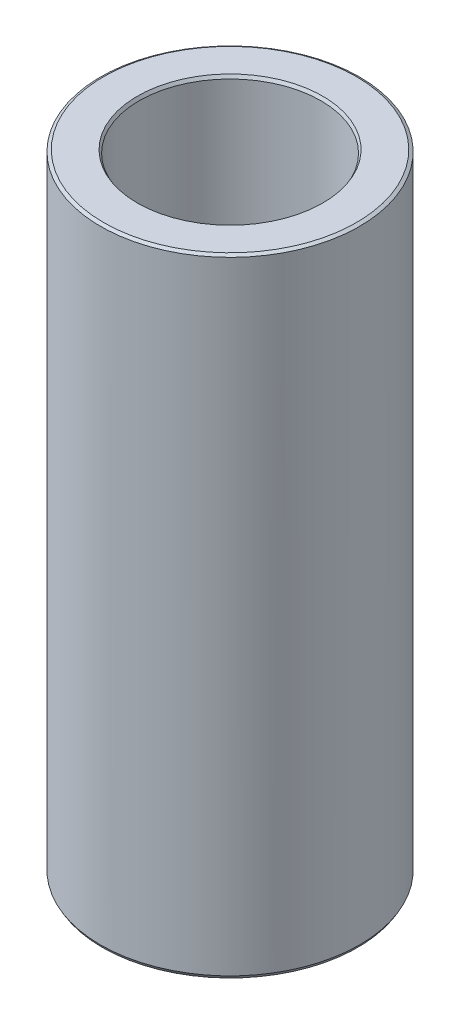
from build123d import *
from OCP.BRepFilletAPI import BRepFilletAPI_MakeChamfer

# Parameters (mm, degrees)
SKETCH1_R           = 52.5
BOSS_EXTRUDE1_DEPTH = 254.278853802
SKETCH2_R           = 36.846720765
CUT_EXTRUDE1_DEPTH  = 265.896650584
CHAMFER1_SIZE       = 0.721615891
CHAMFER1_SIZE2      = 1.249875387


with BuildPart() as part:
    # Sketch1 → Boss-Extrude1 (new body)
    with BuildSketch(Plane(origin=(0, 0, 0), x_dir=(1, 0, 0), z_dir=(0, 1, 0))):
        Circle(SKETCH1_R)
    extrude(amount=BOSS_EXTRUDE1_DEPTH)

    # Sketch2 → Cut-Extrude1 (cut, through all)
    with BuildSketch(Plane(origin=(0, 0, 0), x_dir=(1, 0, 0), z_dir=(0, 1, 0))):
        Circle(SKETCH2_R)
    extrude(amount=CUT_EXTRUDE1_DEPTH, mode=Mode.SUBTRACT)

    # Chamfer1: one chamfer whose edges measure the first distance from different faces: ONE call of the kernel's chamfer builder (chamfer() names one face for all edges)
    chamfer1_edges_1 = [part.edges().sort_by_distance(p)[0] for p in [
        (-36.846720765, 254.278853802, 0),
    ]]
    chamfer1_side_1 = [part.faces().sort_by_distance(p)[0] for p in [
        (-51.01507576, 254.278853802, 0),
    ]]
    chamfer1_edges_2 = [part.edges().sort_by_distance(p)[0] for p in [
        (-36.846720765, 0, 0),
    ]]
    chamfer1_side_2 = [part.faces().sort_by_distance(p)[0] for p in [
        (-36.846720765, 127.139426901, 0),
    ]]
    chamfer1_edges_3 = [part.edges().sort_by_distance(p)[0] for p in [
        (-52.5, 0, 0),
    ]]
    chamfer1_side_3 = [part.faces().sort_by_distance(p)[0] for p in [
        (-51.01507576, 0, 0),
    ]]
    chamfer1_edges_4 = [part.edges().sort_by_distance(p)[0] for p in [
        (-52.5, 254.278853802, 0),
    ]]
    chamfer1_side_4 = [part.faces().sort_by_distance(p)[0] for p in [
        (-52.5, 127.139426901, 0),
    ]]
    chamfer1 = BRepFilletAPI_MakeChamfer(part.part.solid().wrapped)
    for e in chamfer1_edges_1:
        chamfer1.Add(CHAMFER1_SIZE, CHAMFER1_SIZE2, e.wrapped, chamfer1_side_1[0].wrapped)  # the first distance lies on this face
    for e in chamfer1_edges_2:
        chamfer1.Add(CHAMFER1_SIZE, CHAMFER1_SIZE2, e.wrapped, chamfer1_side_2[0].wrapped)  # the first distance lies on this face
    for e in chamfer1_edges_3:
        chamfer1.Add(CHAMFER1_SIZE, CHAMFER1_SIZE2, e.wrapped, chamfer1_side_3[0].wrapped)  # the first distance lies on this face
    for e in chamfer1_edges_4:
        chamfer1.Add(CHAMFER1_SIZE, CHAMFER1_SIZE2, e.wrapped, chamfer1_side_4[0].wrapped)  # the first distance lies on this face
    add(Compound.cast(chamfer1.Shape()), mode=Mode.REPLACE)


solid = part.part
